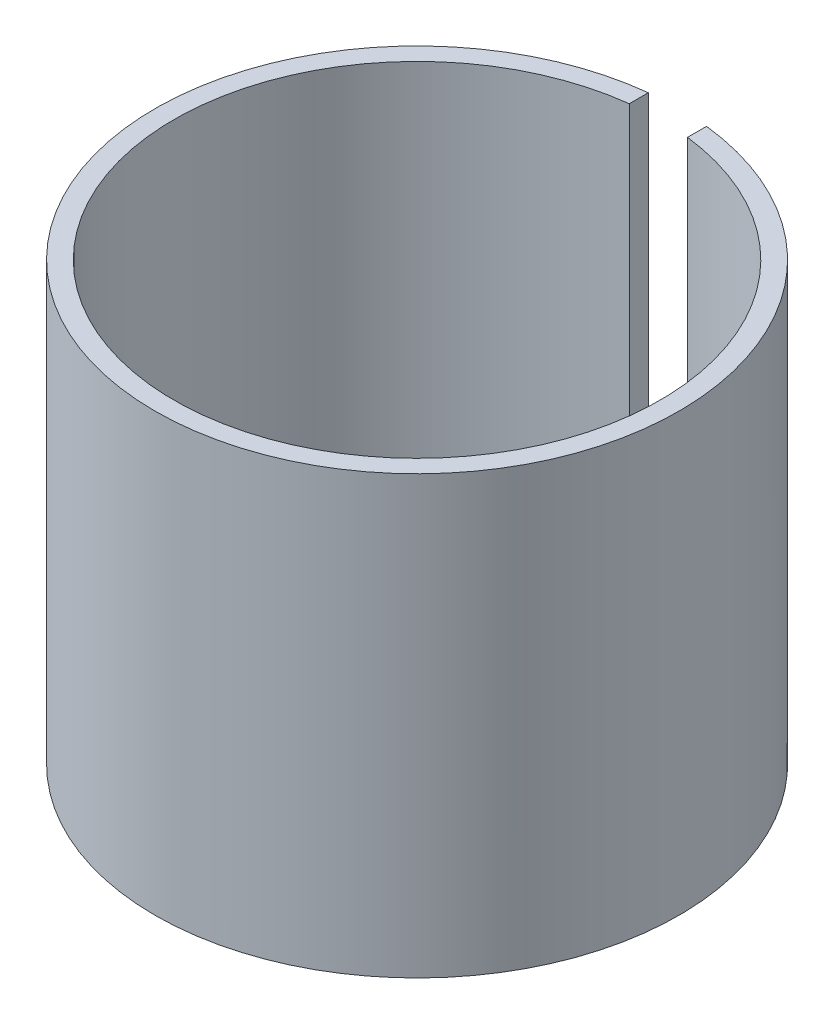
from build123d import *

# Parameters (mm, degrees)
SKETCH1_R           = 18
BOSS_EXTRUDE1_DEPTH = 5
SKETCH2_R           = 18
SKETCH2_R_2         = 16.7
BOSS_EXTRUDE2_DEPTH = 25
SKETCH3_W           = 4
SKETCH3_H           = 4.625561496
CUT_EXTRUDE1_DEPTH  = 25


with BuildPart() as part:
    # Sketch1 → Boss-Extrude1 (new body)
    with BuildSketch(Plane(origin=(0, 0, 0), x_dir=(1, 0, 0), z_dir=(0, 1, 0))):
        with Locations(Location((0, 0, 0), (0, 0, 270))):
            Circle(SKETCH1_R)
    extrude(amount=BOSS_EXTRUDE1_DEPTH)

    # Sketch2 → Boss-Extrude2 (add)
    with BuildSketch(Plane(origin=(0, 5, 0), x_dir=(1, 0, 0), z_dir=(0, 1, 0))):
        with Locations(Location((0, 0, 0), (0, 0, 270))):
            Circle(SKETCH2_R)
        with Locations(Location((0, 0, 0), (0, 0, 270))):
            Circle(SKETCH2_R_2, mode=Mode.SUBTRACT)
    extrude(amount=BOSS_EXTRUDE2_DEPTH)

    # Sketch3 → Cut-Extrude1 (cut)
    with BuildSketch(Plane(origin=(0, 30, 0), x_dir=(1, 0, 0), z_dir=(0, 1, 0))):
        with Locations((0, 16.7)):
            Rectangle(SKETCH3_W, SKETCH3_H)
    extrude(amount=-CUT_EXTRUDE1_DEPTH, mode=Mode.SUBTRACT)

    # Cut-Loft1: read off the stored shape, not the designer's step
    # Cut-Loft1: loft between two sections, ruled curve by curve
    cut_loft1_from = [
        Edge.make_bspline([(-1.712462043, 0, -8.966813787), (-1.626363192, 0, -8.824108617), (-1.511615223, 0, -8.673150149), (-1.197727621, 0, -8.384153579), (-0.9972614, 0, -8.245981525), (-0.502854414, 0, -8.045966083), (-0.20751606, 0, -7.986207367), (0.419056865, 0, -8.019390239), (0.747775872, 0, -8.115340255), (1.318596553, 0, -8.459735659), (1.556747911, 0, -8.705797688), (1.878250858, 0, -9.244621024), (1.963090928, 0, -9.533754229), (2.016671796, 0, -10.064389259), (1.987908436, 0, -10.306155451), (1.878602966, 0, -10.718583333), (1.798560894, 0, -10.890481042), (1.626363192, 0, -11.175891383), (1.511615223, 0, -11.326849851), (1.197727621, 0, -11.615846421), (0.9972614, 0, -11.754018475), (0.502854414, 0, -11.954033917), (0.20751606, 0, -12.013792633), (-0.419056865, 0, -11.980609761), (-0.747775872, 0, -11.884659745), (-1.318596553, 0, -11.540264341), (-1.556747911, 0, -11.294202312), (-1.878250858, 0, -10.755378976), (-1.963090928, 0, -10.466245771), (-2.016671796, 0, -9.935610741), (-1.987908436, 0, -9.693844549), (-1.878602966, 0, -9.281416667), (-1.798560894, 0, -9.109518958), (-1.712462043, 0, -8.966813787)], [0, 0, 0, 0, 0.0625, 0.0625, 0.125, 0.125, 0.1875, 0.1875, 0.25, 0.25, 0.3125, 0.3125, 0.375, 0.375, 0.4375, 0.4375, 0.5, 0.5, 0.5625, 0.5625, 0.625, 0.625, 0.6875, 0.6875, 0.75, 0.75, 0.8125, 0.8125, 0.875, 0.875, 0.9375, 0.9375, 1, 1, 1, 1], 3),
    ]
    cut_loft1_to = [
        Edge.make_bspline([(-1.509327554, 5, -13.687776568), (-1.399975601, 5, -13.561999272), (-1.260982153, 5, -13.433017192), (-0.902081628, 5, -13.202290388), (-0.680844687, 5, -13.100641787), (-0.15941128, 5, -12.988607658), (0.14180355, 5, -12.980516047), (0.75334128, 5, -13.120930922), (1.06066884, 5, -13.271968541), (1.563778024, 5, -13.709376352), (1.756077925, 5, -13.9927195), (1.980154065, 5, -14.578795106), (2.014020397, 5, -14.8782094), (1.975571807, 5, -15.410155027), (1.905670109, 5, -15.643375898), (1.727083916, 5, -16.030869661), (1.618679506, 5, -16.186446136), (1.399975601, 5, -16.438000728), (1.260982153, 5, -16.566982808), (0.902081628, 5, -16.797709612), (0.680844687, 5, -16.899358213), (0.15941128, 5, -17.011392342), (-0.14180355, 5, -17.019483953), (-0.75334128, 5, -16.879069078), (-1.06066884, 5, -16.728031459), (-1.563778024, 5, -16.290623648), (-1.756077925, 5, -16.0072805), (-1.980154065, 5, -15.421204894), (-2.014020397, 5, -15.1217906), (-1.975571807, 5, -14.589844973), (-1.905670109, 5, -14.356624102), (-1.727083916, 5, -13.969130339), (-1.618679506, 5, -13.813553864), (-1.509327554, 5, -13.687776568)], [0, 0, 0, 0, 0.0625, 0.0625, 0.125, 0.125, 0.1875, 0.1875, 0.25, 0.25, 0.3125, 0.3125, 0.375, 0.375, 0.4375, 0.4375, 0.5, 0.5, 0.5625, 0.5625, 0.625, 0.625, 0.6875, 0.6875, 0.75, 0.75, 0.8125, 0.8125, 0.875, 0.875, 0.9375, 0.9375, 1, 1, 1, 1], 3),
    ]
    cut_loft1 = Solid(Shell([*[Face.make_surface_from_curves(cut_loft1_from[k], cut_loft1_to[k]) for k in range(1)], Face(Wire(cut_loft1_from)), Face(Wire(cut_loft1_to))]))
    add(cut_loft1, mode=Mode.SUBTRACT)


solid = part.part
